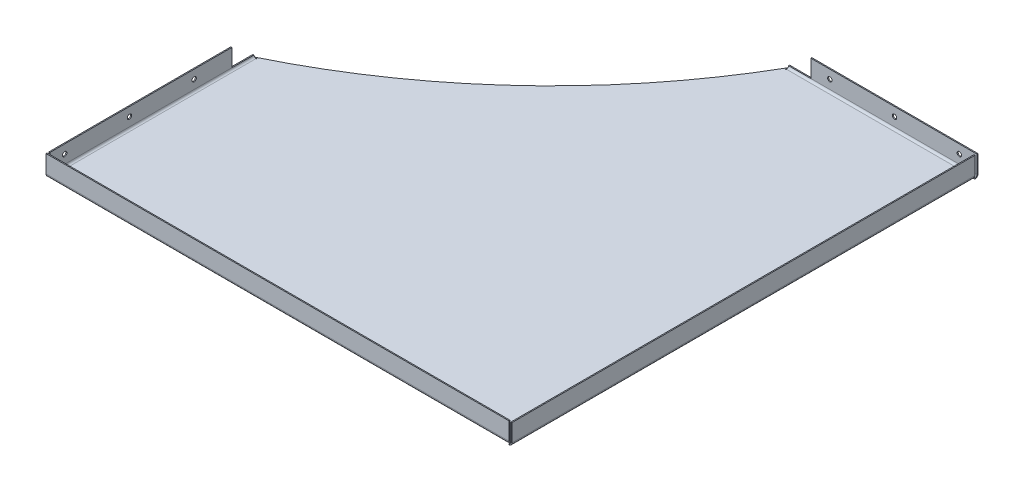
from build123d import *

# Parameters (mm, degrees)
BASE_FLANGE1_DEPTH            = 2
EDGE_FLANGE1_STRIP_W          = 16
EDGE_FLANGE1_STRIP_H          = 2
EDGE_FLANGE1_STRIP_CUT_DEPTH  = 363.829009869
EDGE_FLANGE1_RELIEF_W         = 17
EDGE_FLANGE1_RELIEF_H         = 1
EDGE_FLANGE1_RELIEF_CUT_DEPTH = 2
EDGE_FLANGE1_DEPTH            = 363.829009869
EDGE_FLANGE2_STRIP_W          = 16
EDGE_FLANGE2_STRIP_H          = 2
EDGE_FLANGE2_STRIP_CUT_DEPTH  = 894
EDGE_FLANGE2_DEPTH            = 894
EDGE_FLANGE3_STRIP_W          = 16
EDGE_FLANGE3_STRIP_H          = 2
EDGE_FLANGE3_STRIP_CUT_DEPTH  = 894
EDGE_FLANGE3_DEPTH            = 894
EDGE_FLANGE4_START            = 1915.177869048
EDGE_FLANGE4_DEPTH            = 394.75629901
EDGE_FLANGE4_2_DEPTH          = 1
EDGE_FLANGE4_START_2          = 1916.177869048
EDGE_FLANGE4_3_DEPTH          = 393.75629901
SKETCH20_W                    = 43
SKETCH20_H                    = 34
CUT_EXTRUDE1_DEPTH            = 10
SKETCH21_W                    = 43
SKETCH21_H                    = 34
CUT_EXTRUDE2_DEPTH            = 10
SKETCH22_R                    = 4.25
CUT_EXTRUDE3_DEPTH            = 10
SKETCH23_R                    = 4.25
CUT_EXTRUDE4_DEPTH            = 10


# Read off the part's stored shape, not the designer's step: Edge-Flange4
# Sheet-metal steps are written as plain solids
with BuildPart() as part:
    # Sketch1 → Base-Flange1 (new body)
    with BuildSketch(Plane(origin=(0, 0, 0), x_dir=(1, 0, 0), z_dir=(0, 1, 0))):
        with BuildLine():
            Line((-2530.611542613, -1415.934168058), (-2166.782532744, -1415.934168058))
            Line((-2166.782532744, -1415.934168058), (-2166.782532744, -2315.934168058))
            Line((-2166.782532744, -2315.934168058), (-3066.782532744, -2315.934168058))
            Line((-3066.782532744, -2315.934168058), (-3066.782532744, -1916.177869048))
            ThreePointArc((-3066.782532744, -1916.177869048), (-2760.872899609, -1706.596670078), (-2530.611542613, -1415.934168058))
        make_face()
    extrude(amount=-BASE_FLANGE1_DEPTH)

    # Edge-Flange1 strip (across the edge) → Edge-Flange1 strip cut (cut)
    with BuildSketch(Plane(origin=(-2166.782532744, 0, 1415.934168058), x_dir=(0, 0, 1), z_dir=(-1, 0, 0))):
        with Locations((-2, -1)):
            Rectangle(EDGE_FLANGE1_STRIP_W, EDGE_FLANGE1_STRIP_H)
    extrude(amount=EDGE_FLANGE1_STRIP_CUT_DEPTH, mode=Mode.SUBTRACT)

    # Edge-Flange1 relief (on the sheet) → Edge-Flange1 relief cut (cut)
    with BuildSketch(Plane(origin=(-2166.782532744, 0, 1421.934168058), x_dir=(0, 0, 1), z_dir=(0, 1, 0))):
        with Locations((-7.5, -364.329009869)):
            Rectangle(EDGE_FLANGE1_RELIEF_W, EDGE_FLANGE1_RELIEF_H)
    extrude(amount=-EDGE_FLANGE1_RELIEF_CUT_DEPTH, mode=Mode.SUBTRACT)

    # Edge-Flange1 section (across the edge) → Edge-Flange1 (add)
    with BuildSketch(Plane(origin=(-2166.782532744, 0, 1415.934168058), x_dir=(0, 0, 1), z_dir=(-1, 0, 0))):
        with BuildLine():
            Line((0, 4), (0, 38))
            Line((0, 38), (2, 38))
            Line((2, 38), (2, 4))
            ThreePointArc((2, 4), (3.171572875, 1.171572875), (6, 0))
            Line((6, 0), (6, -2))
            ThreePointArc((6, -2), (1.757359313, -0.242640687), (0, 4))
        make_face()
    extrude(amount=EDGE_FLANGE1_DEPTH)

    # Edge-Flange2 strip (across the edge) → Edge-Flange2 strip cut (cut)
    with BuildSketch(Plane(origin=(-2166.782532744, 0, 2315.934168058), x_dir=(-1, 0, 0), z_dir=(0, 0, -1))):
        with Locations((-2, -1)):
            Rectangle(EDGE_FLANGE2_STRIP_W, EDGE_FLANGE2_STRIP_H)
    extrude(amount=EDGE_FLANGE2_STRIP_CUT_DEPTH, mode=Mode.SUBTRACT)

    # Edge-Flange2 section (across the edge) → Edge-Flange2 (add)
    with BuildSketch(Plane(origin=(-2166.782532744, 0, 2315.934168058), x_dir=(-1, 0, 0), z_dir=(0, 0, -1))):
        with BuildLine():
            Line((0, 4), (0, 38))
            Line((0, 38), (2, 38))
            Line((2, 38), (2, 4))
            ThreePointArc((2, 4), (3.171572875, 1.171572875), (6, 0))
            Line((6, 0), (6, -2))
            ThreePointArc((6, -2), (1.757359313, -0.242640687), (0, 4))
        make_face()
    extrude(amount=EDGE_FLANGE2_DEPTH)

    # Edge-Flange3 strip (across the edge) → Edge-Flange3 strip cut (cut)
    with BuildSketch(Plane(origin=(-3066.782532744, 0, 2315.934168058), x_dir=(0, 0, -1), z_dir=(1, 0, 0))):
        with Locations((-2, -1)):
            Rectangle(EDGE_FLANGE3_STRIP_W, EDGE_FLANGE3_STRIP_H)
    extrude(amount=EDGE_FLANGE3_STRIP_CUT_DEPTH, mode=Mode.SUBTRACT)

    # Edge-Flange3 section (across the edge) → Edge-Flange3 (add)
    with BuildSketch(Plane(origin=(-3066.782532744, 0, 2315.934168058), x_dir=(0, 0, -1), z_dir=(1, 0, 0))):
        with BuildLine():
            Line((0, 4), (0, 38))
            Line((0, 38), (2, 38))
            Line((2, 38), (2, 4))
            ThreePointArc((2, 4), (3.171572875, 1.171572875), (6, 0))
            Line((6, 0), (6, -2))
            ThreePointArc((6, -2), (1.757359313, -0.242640687), (0, 4))
        make_face()
    extrude(amount=EDGE_FLANGE3_DEPTH)

    # Edge-Flange4 outline → Edge-Flange4 (cut)
    with BuildSketch(Plane.XY.offset(EDGE_FLANGE4_START)):
        with BuildLine():
            ThreePointArc((-3060.782532744, -2), (-3063.232022487, -1.477225575), (-3065.254668699, 0))
            Line((-3065.254668699, 0), (-3066.782532744, 0))
            Line((-3066.782532744, 0), (-3066.782532744, -2))
            Line((-3066.782532744, -2), (-3060.782532744, -2))
        make_face()
    extrude(amount=EDGE_FLANGE4_DEPTH, mode=Mode.SUBTRACT)

    # Edge-Flange4 2 outline → Edge-Flange4 2 (cut)
    with BuildSketch(Plane.XY.offset(EDGE_FLANGE4_START)):
        with BuildLine():
            Line((-3059.782532744, 0), (-3065.254668699, 0))
            ThreePointArc((-3065.254668699, 0), (-3063.232022487, -1.477225575), (-3060.782532744, -2))
            Line((-3060.782532744, -2), (-3059.782532744, -2))
            Line((-3059.782532744, -2), (-3059.782532744, 0))
        make_face()
    extrude(amount=EDGE_FLANGE4_2_DEPTH, mode=Mode.SUBTRACT)

    # Edge-Flange4 3 outline → Edge-Flange4 3 (add)
    with BuildSketch(Plane.XY.offset(EDGE_FLANGE4_START_2)):
        with BuildLine():
            Line((-3064.782532744, 38), (-3066.782532744, 38))
            Line((-3066.782532744, 38), (-3066.782532744, 4))
            ThreePointArc((-3066.782532744, 4), (-3066.387566898, 1.859067461), (-3065.254668699, 0))
            Line((-3065.254668699, 0), (-3060.782532744, 0))
            ThreePointArc((-3060.782532744, 0), (-3063.610959869, 1.171572875), (-3064.782532744, 4))
            Line((-3064.782532744, 4), (-3064.782532744, 38))
        make_face()
    extrude(amount=EDGE_FLANGE4_3_DEPTH)

    # Sketch20 → Cut-Extrude1 (cut)
    with BuildSketch(Plane.ZY.offset(3066.782532744)):
        with Locations((1937.677869048, 21)):
            Rectangle(SKETCH20_W, SKETCH20_H)
    extrude(amount=-CUT_EXTRUDE1_DEPTH, mode=Mode.SUBTRACT)

    # Sketch21 → Cut-Extrude2 (cut)
    with BuildSketch(Plane(origin=(0, 0, 1415.934168058), x_dir=(-1, 0, 0), z_dir=(0, 0, -1))):
        with Locations((2509.111542613, 21)):
            Rectangle(SKETCH21_W, SKETCH21_H)
    extrude(amount=-CUT_EXTRUDE2_DEPTH, mode=Mode.SUBTRACT)

    # Sketch22 → Cut-Extrude3 (cut)
    with BuildSketch(Plane(origin=(0, 0, 1415.934168058), x_dir=(-1, 0, 0), z_dir=(0, 0, -1))):
        with Locations(Location((2200.932532744, 21, 0), (0, 0, 90))):
            Circle(SKETCH22_R)
        with Locations(Location((2325.932532744, 21, 0), (0, 0, 90))):
            Circle(SKETCH22_R)
        with Locations(Location((2450.932532744, 21, 0), (0, 0, 90))):
            Circle(SKETCH22_R)
    extrude(amount=-CUT_EXTRUDE3_DEPTH, mode=Mode.SUBTRACT)

    # Sketch23 → Cut-Extrude4 (cut)
    with BuildSketch(Plane.ZY.offset(3066.782532744)):
        with Locations((2281.784168058, 21)):
            Circle(SKETCH23_R)
        with Locations((2156.784168058, 21)):
            Circle(SKETCH23_R)
        with Locations((2031.784168058, 21)):
            Circle(SKETCH23_R)
    extrude(amount=-CUT_EXTRUDE4_DEPTH, mode=Mode.SUBTRACT)


solid = part.part
